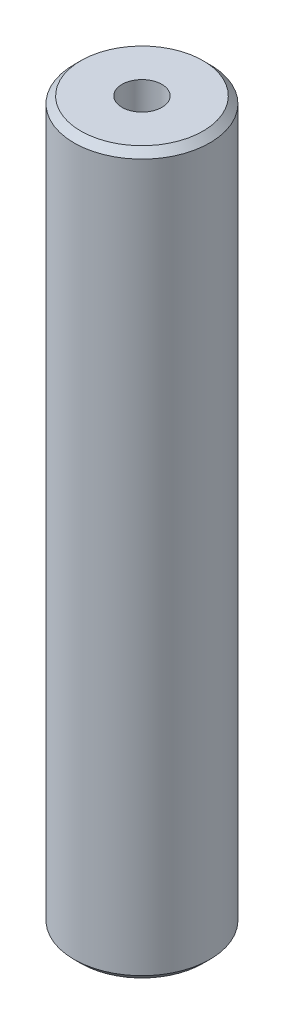
from build123d import *

# Parameters (mm, degrees)
SKETCH1_R           = 10
BOSS_EXTRUDE1_DEPTH = 106.173128395
SKETCH2_R           = 2.940143383
CUT_EXTRUDE1_DEPTH  = 108.110845357
CHAMFER1_SIZE       = 1.003588818


with BuildPart() as part:
    # Sketch1 → Boss-Extrude1 (new body)
    with BuildSketch(Plane(origin=(0, 0, 0), x_dir=(1, 0, 0), z_dir=(0, 1, 0))):
        Circle(SKETCH1_R)
    extrude(amount=BOSS_EXTRUDE1_DEPTH)

    # Sketch2 → Cut-Extrude1 (cut, through all)
    with BuildSketch(Plane(origin=(0, 0, 0), x_dir=(1, 0, 0), z_dir=(0, 1, 0))):
        Circle(SKETCH2_R)
    extrude(amount=CUT_EXTRUDE1_DEPTH, mode=Mode.SUBTRACT)

    # Chamfer1
    chamfer1_edges = [part.edges().sort_by_distance(p)[0] for p in [
        (-10, 106.173128395, 0),
        (-10, 0, 0),
    ]]
    chamfer(chamfer1_edges, length=CHAMFER1_SIZE)


solid = part.part
